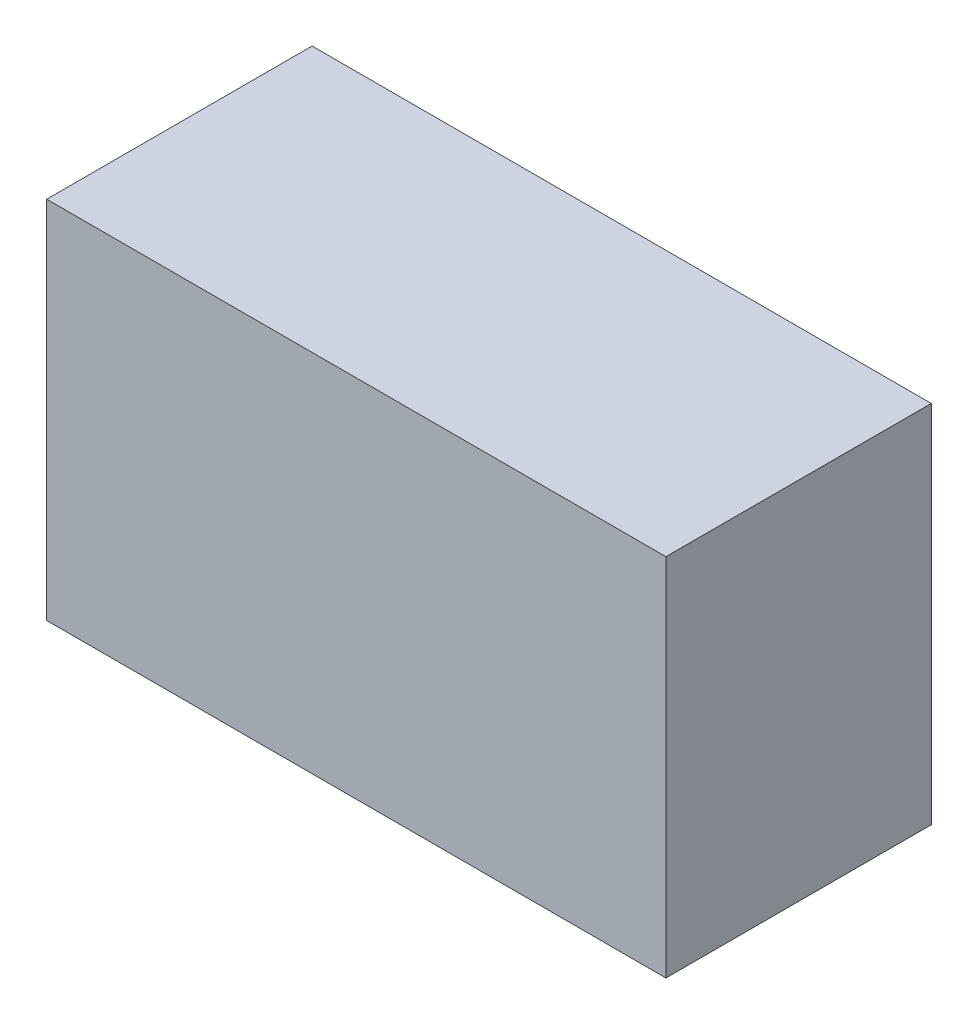
from build123d import *

# Parameters (mm, degrees)
SKETCH1_W           = 711.2
SKETCH1_H           = 419.1
BOSS_EXTRUDE1_DEPTH = 152.4


with BuildPart() as part:
    # Sketch1 → Boss-Extrude1 (new, symmetric)
    with BuildSketch(Plane.XY):
        Rectangle(SKETCH1_W, SKETCH1_H)
    extrude(amount=BOSS_EXTRUDE1_DEPTH, both=True)


solid = part.part
